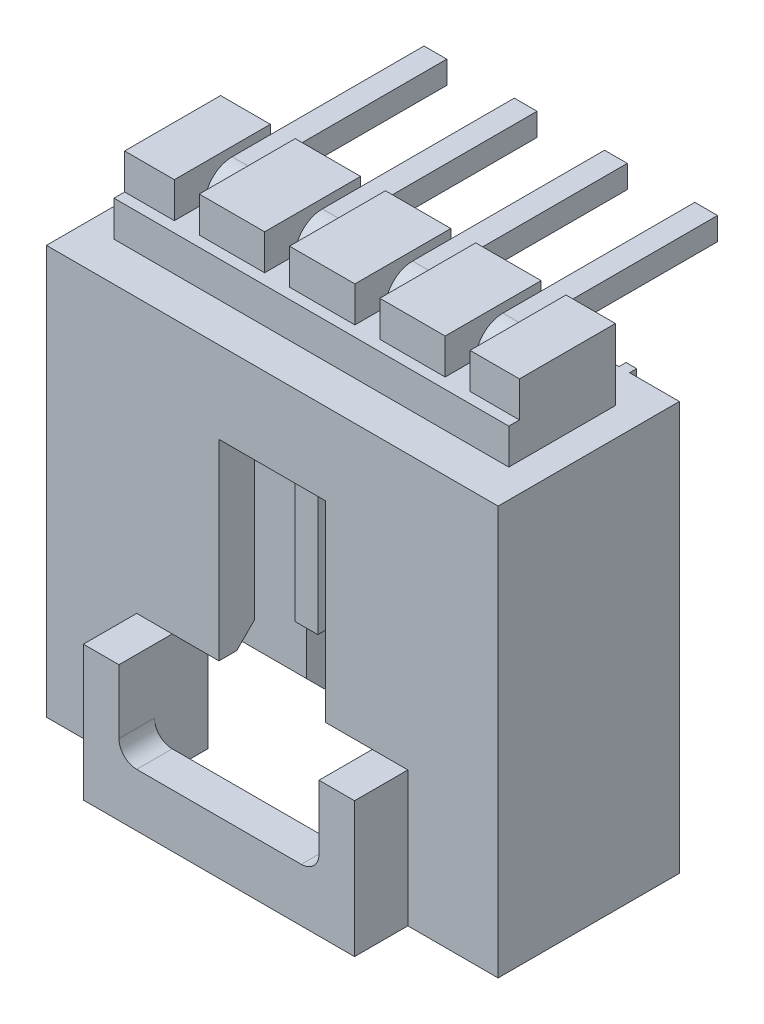
from build123d import *

# Parameters (mm, degrees)
EXTRUDE_START                      = 0.2
EXTRUDE_1_DEPTH                    = 5.1
SKETCH_7_W                         = 0.3
SKETCH_7_H                         = 0.2
EXTRUDE_4_DEPTH                    = 11.5
SKETCH_8_W                         = 1
SKETCH_8_H                         = 2
CUT_EXTRUDE_5_DEPTH                = 11.11
CUT_EXTRUDE_1_DEPTH                = 9.2
EXTRUDE_2_DEPTH                    = 3.8
SKETCH_4_W                         = 5.63
SKETCH_4_H                         = 1
CUT_EXTRUDE_2_DEPTH                = 3.8
CUT_EXTRUDE_3_REACH                = 17.948
CHAMFER_1_SIZE                     = 0.5
CUT_EXTRUDE_6_REACH                = 16.943
SKETCH_9_W                         = 0.7
SKETCH_9_H                         = 1
SWEEP_START                        = 3.49
SWEEP_1_DEPTH                      = 0.64
CHAMFER_2_SIZE                     = 0.2
PATTERN_LINEAR_2_COUNT             = 4
PATTERN_LINEAR_2_PITCH             = 2.54
PATTERN_LINEAR_1_COUNT             = 4
PATTERN_LINEAR_1_PITCH             = 2.54
CHAMFER_2_OF_PATTERN_LINEAR_1_SIZE = 0.2


# Read off the part's stored shape, not the designer's step: По траектории1
with BuildPart() as part:
    # Эскиз1 → Бобышка-Вытянуть1 (new body)
    with BuildSketch(Plane.XY.offset(EXTRUDE_START)):
        Polygon((-5.555, 0.55), (5.555, 0.55), (5.555, -1.45), (6.355, -1.45), (6.355, -12.95), (-6.355, -12.95), (-6.355, -1.45), (-5.555, -1.45), align=None)
    extrude(amount=EXTRUDE_1_DEPTH)

    # Эскиз7 → Бобышка-Вытянуть4 (add)
    with BuildSketch(Plane.XZ.offset(12.95)):
        with Locations((4.805, 0.1)):
            Rectangle(SKETCH_7_W, SKETCH_7_H)
        with Locations((-4.805, 0.1)):
            Rectangle(SKETCH_7_W, SKETCH_7_H)
    extrude(amount=-EXTRUDE_4_DEPTH)

    # Эскиз8 → Вырез-Вытянуть5 (cut)
    with BuildSketch(Plane(origin=(5.555, 0, 0), x_dir=(0, 0, -1), z_dir=(1, 0, 0))):
        with Locations((-0.7, -0.45)):
            Rectangle(SKETCH_8_W, SKETCH_8_H)
        Polygon((-4.2, -1.45), (-5.3, -1.45), (-5.3, 0.55), (-3.9, 0.55), (-3.9, -0.45), (-4.2, -0.45), align=None)
    extrude(amount=-CUT_EXTRUDE_5_DEPTH, mode=Mode.SUBTRACT)

    # Эскиз2 → Вырез-Вытянуть1 (cut)
    with BuildSketch(Plane.XZ.offset(12.95)):
        Polygon((-5.355, 4.3), (-5.355, 1.2), (-3.14, 1.2), (-3.14, 0.2), (-1.94, 0.2), (-1.94, 1.2), (1.94, 1.2), (1.94, 0.2), (3.14, 0.2), (3.14, 1.2), (5.355, 1.2), (5.355, 4.3), (1.5, 4.3), (1.5, 5.3), (-1.5, 5.3), (-1.5, 4.3), align=None)
    extrude(amount=-CUT_EXTRUDE_1_DEPTH, mode=Mode.SUBTRACT)

    # Эскиз3 → Бобышка-Вытянуть2 (add)
    with BuildSketch(Plane.XZ.offset(12.95)):
        Polygon((-3.815, 5.3), (-3.815, 6.8), (3.815, 6.8), (3.815, 5.3), (2.815, 5.3), (2.815, 5.8), (-2.815, 5.8), (-2.815, 5.3), align=None)
    extrude(amount=-EXTRUDE_2_DEPTH)

    # Эскиз4 → Вырез-Вытянуть2 (cut)
    with BuildSketch(Plane.XZ.offset(12.95)):
        with Locations((0, 4.8)):
            Rectangle(SKETCH_4_W, SKETCH_4_H)
    extrude(amount=-CUT_EXTRUDE_2_DEPTH, mode=Mode.SUBTRACT)

    # Эскиз5 → Вырез-Вытянуть3 (cut, up to next)
    with BuildSketch(Plane.XY.offset(6.8), mode=Mode.PRIVATE) as cut_extrude_3_sk1:
        with BuildLine():
            Line((2.815, -9.15), (2.815, -10.95))
            ThreePointArc((2.815, -10.95), (2.668553391, -11.303553391), (2.315, -11.45))
            Line((2.315, -11.45), (-2.315, -11.45))
            ThreePointArc((-2.315, -11.45), (-2.668553391, -11.303553391), (-2.815, -10.95))
            Line((-2.815, -10.95), (-2.815, -9.15))
            Line((-2.815, -9.15), (2.815, -9.15))
        make_face()
    cut_extrude_3_tool1 = extrude(cut_extrude_3_sk1.sketch, amount=-CUT_EXTRUDE_3_REACH, mode=Mode.PRIVATE) & part.part
    add(cut_extrude_3_tool1.solids().sort_by_distance((0, -10.291324, 6.8))[0], mode=Mode.SUBTRACT)

    # Фаска1
    chamfer_1_edges = [part.edges().sort_by_distance(p)[0] for p in [
        (-2.815, -12.95, 5.05),
        (0, -12.95, 5.8),
        (2.815, -12.95, 5.05),
        (2.1575, -9.15, 4.3),
        (-4.085, -12.95, 4.3),
        (-2.1575, -9.15, 4.3),
        (-5.355, -12.95, 2.75),
        (-4.2475, -12.95, 1.2),
        (0, -12.95, 1.2),
        (4.2475, -12.95, 1.2),
        (5.355, -12.95, 2.75),
        (4.085, -12.95, 4.3),
    ]]
    chamfer(chamfer_1_edges, length=CHAMFER_1_SIZE)

    # Эскиз9 → Вырез-Вытянуть6 (cut, up to next)
    with BuildSketch(Plane.XY.offset(3.9), mode=Mode.PRIVATE) as cut_extrude_6_sk1:
        with Locations((3.815, 0.05)):
            Rectangle(SKETCH_9_W, SKETCH_9_H)
    cut_extrude_6_tool1 = extrude(cut_extrude_6_sk1.sketch, amount=-CUT_EXTRUDE_6_REACH, mode=Mode.PRIVATE) & part.part
    cut_extrude_6 = cut_extrude_6_tool1.solids().sort_by_distance((3.815, 0.05, 3.9))[0]
    add(cut_extrude_6, mode=Mode.SUBTRACT)

    # По траектории1 outline → По траектории1 (add)
    with BuildSketch(Plane.YZ.offset(SWEEP_START)):
        with BuildLine():
            Line((-3.75, 2.43), (-3.75, 3.07))
            add(Edge.make_bspline(
                [(-3.75, 3.07), (-4.166666667, 3.07), (-4.583333333, 3.07), (-6.516666667, 3.07), (-8.033333333, 3.07), (-9.55, 3.07)],
                knots=[0.623544277, 0.623544277, 0.623544277, 0.623544277, 0.704676976, 0.704676976, 1, 1, 1, 1], degree=3))
            Line((-9.55, 3.07), (-9.55, 2.43))
            Line((-9.55, 2.43), (-3.75, 2.43))
        make_face()
        with BuildLine():
            Line((0.32, -3.3), (0.32, 2.3))
            add(Edge.make_bspline(
                [(0.32, 2.3), (0.32, 2.499654349), (0.23877091, 2.700173533), (0.022322877, 2.916621566), (-0.064240468, 2.973940923), (-0.250203983, 3.050392149), (-0.370157621, 3.069944018), (-0.45, 3.07)],
                knots=[0.363474491, 0.363474491, 0.363474491, 0.363474491, 0.386414221, 0.386414221, 0.397884087, 0.397884087, 0.409353952, 0.409353952, 0.409353952, 0.409353952], degree=3))
            Line((-0.45, 3.07), (-0.45, 2.43))
            ThreePointArc((-0.45, 2.43), (-0.358076118, 2.391923882), (-0.32, 2.3))
            Line((-0.32, 2.3), (-0.32, -3.3))
            Line((-0.32, -3.3), (0.32, -3.3))
        make_face()
    sweep_1 = extrude(amount=SWEEP_1_DEPTH)

    # Фаска2
    chamfer_2_edges = [part.edges().sort_by_distance(p)[0] for p in [
        (3.81, -9.55, 3.07),
        (4.13, -9.55, 2.75),
        (3.81, -9.55, 2.43),
        (3.49, -9.55, 2.75),
        (3.81, -0.32, -3.3),
        (4.13, 0, -3.3),
        (3.81, 0.32, -3.3),
        (3.49, 0, -3.3),
    ]]
    chamfer(chamfer_2_edges, length=CHAMFER_2_SIZE)

    # Линейный массив2: Вырез-Вытянуть6 ×4
    with Locations(*[(-i * PATTERN_LINEAR_2_PITCH, 0, 0) for i in range(1, PATTERN_LINEAR_2_COUNT)]):
        add(cut_extrude_6, mode=Mode.SUBTRACT)

    # Линейный массив1: По траектории1 ×4
    with Locations(*[(-i * PATTERN_LINEAR_1_PITCH, 0, 0) for i in range(1, PATTERN_LINEAR_1_COUNT)]):
        add(sweep_1)

    # Фаска2 of Линейный массив1
    chamfer_2_of_pattern_linear_1_edges = [part.edges().sort_by_distance(p)[0] for p in [
        (1.27, -9.55, 3.07),
        (1.59, -9.55, 2.75),
        (1.27, -9.55, 2.43),
        (0.95, -9.55, 2.75),
        (1.27, -0.32, -3.3),
        (1.59, 0, -3.3),
        (1.27, 0.32, -3.3),
        (0.95, 0, -3.3),
        (-1.27, -9.55, 3.07),
        (-0.95, -9.55, 2.75),
        (-1.27, -9.55, 2.43),
        (-1.59, -9.55, 2.75),
        (-1.27, -0.32, -3.3),
        (-0.95, 0, -3.3),
        (-1.27, 0.32, -3.3),
        (-1.59, 0, -3.3),
        (-3.81, -9.55, 3.07),
        (-3.49, -9.55, 2.75),
        (-3.81, -9.55, 2.43),
        (-4.13, -9.55, 2.75),
        (-3.81, -0.32, -3.3),
        (-3.49, 0, -3.3),
        (-3.81, 0.32, -3.3),
        (-4.13, 0, -3.3),
    ]]
    chamfer(chamfer_2_of_pattern_linear_1_edges, length=CHAMFER_2_OF_PATTERN_LINEAR_1_SIZE)


solid = part.part
